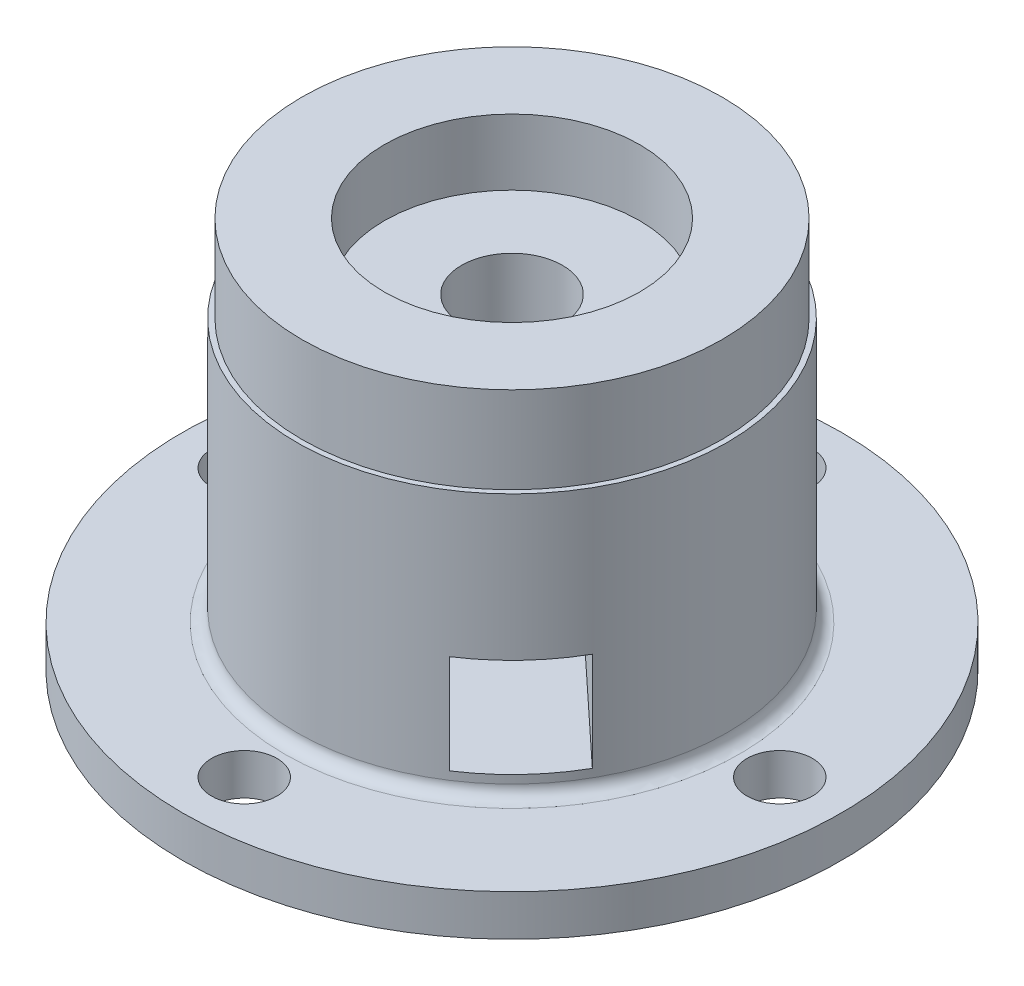
from build123d import *

# Parameters (mm, degrees)
CROQUIS1_R                  = 52.25
CROQUIS1_R_2                = 12.25
EXTRUIR_L_MINA1_DEPTH       = 64
CROQUIS3_R                  = 80
CROQUIS3_R_2                = 17.25
SALIENTE_EXTRUIR1_DEPTH     = 10
EXTRUIR_L_MINA2_OUTLINE_R   = 51
EXTRUIR_L_MINA2_OUTLINE_R_2 = 31
EXTRUIR_L_MINA2_DEPTH       = 21
EXTRUIR_L_MINA2_2_OUTLINE_R = 31
EXTRUIR_L_MINA2_2_DEPTH     = 5
EXTRUIR_L_MINA2_START       = 16
EXTRUIR_L_MINA2_3_OUTLINE_R = 31
EXTRUIR_L_MINA2_3_DEPTH     = 5
CORTAR_EXTRUIR2_START       = -8
CROQUIS6_R                  = 31
CORTAR_EXTRUIR2_DEPTH       = 8
CORTAR_EXTRUIR4_START       = -23
CROQUIS7_R                  = 12.25
CORTAR_EXTRUIR4_DEPTH       = 23
CROQUIS8_R                  = 7.94
CORTAR_EXTRUIR5_DEPTH       = 10
REDONDEO3_R                 = 3
CORTAR_EXTRUIR6_START       = -40
CROQUIS9_R                  = 17.25
CORTAR_EXTRUIR6_DEPTH       = 40
CROQUIS10_W                 = 24.5
CROQUIS10_H                 = 16
CORTAR_EXTRUIR7_DEPTH       = 42
CROQUIS11_W                 = 24.5
CROQUIS11_H                 = 8
CORTAR_EXTRUIR8_DEPTH       = 42


# Read off the part's stored shape, not the designer's step: Extruir-Lámina2
with BuildPart() as part:
    # Croquis1 → Extruir-Lámina1 (new body)
    with BuildSketch(Plane(origin=(0, 0, 0), x_dir=(1, 0, 0), z_dir=(0, 1, 0))):
        Circle(CROQUIS1_R)
        Circle(CROQUIS1_R_2, mode=Mode.SUBTRACT)
    extrude(amount=EXTRUIR_L_MINA1_DEPTH)

    # Croquis3 → Saliente-Extruir1 (add)
    with BuildSketch(Plane(origin=(0, 0, 0), x_dir=(1, 0, 0), z_dir=(0, 1, 0))):
        with Locations(Location((0, 0, 0), (0, 0, 270))):
            Circle(CROQUIS3_R)
        with Locations(Location((0, 0, 0), (0, 0, 270))):
            Circle(CROQUIS3_R_2, mode=Mode.SUBTRACT)
    extrude(amount=-SALIENTE_EXTRUIR1_DEPTH)

    # Extruir-Lámina2 outline → Extruir-Lámina2 (add)
    with BuildSketch(Plane(origin=(0, 64, 0), x_dir=(1, 0, 0), z_dir=(0, 1, 0))):
        Circle(EXTRUIR_L_MINA2_OUTLINE_R)
        Circle(EXTRUIR_L_MINA2_OUTLINE_R_2, mode=Mode.SUBTRACT)
    extrude(amount=EXTRUIR_L_MINA2_DEPTH)

    # Extruir-L_mina2 2 outline → Extruir-L_mina2 2 (add)
    with BuildSketch(Plane(origin=(0, 64, 0), x_dir=(1, 0, 0), z_dir=(0, 1, 0))):
        Circle(EXTRUIR_L_MINA2_2_OUTLINE_R)
    extrude(amount=EXTRUIR_L_MINA2_2_DEPTH)

    # Extruir-L_mina2 3 outline → Extruir-L_mina2 3 (add)
    with BuildSketch(Plane(origin=(0, 64, 0), x_dir=(1, 0, 0), z_dir=(0, 1, 0)).offset(EXTRUIR_L_MINA2_START)):
        Circle(EXTRUIR_L_MINA2_3_OUTLINE_R)
    extrude(amount=EXTRUIR_L_MINA2_3_DEPTH)

    # Croquis6 → Cortar-Extruir2 (cut)
    with BuildSketch(Plane(origin=(0, 85, 0), x_dir=(1, 0, 0), z_dir=(0, 1, 0)).offset(CORTAR_EXTRUIR2_START)):
        with Locations(Location((0, 0, 0), (0, 0, 270))):
            Circle(CROQUIS6_R)
    extrude(amount=CORTAR_EXTRUIR2_DEPTH, mode=Mode.SUBTRACT)

    # Croquis7 → Cortar-Extruir4 (cut)
    with BuildSketch(Plane(origin=(0, 69, 0), x_dir=(1, 0, 0), z_dir=(0, 1, 0)).offset(CORTAR_EXTRUIR4_START)):
        with Locations(Location((0, 0, 0), (0, 0, 270))):
            Circle(CROQUIS7_R)
    extrude(amount=CORTAR_EXTRUIR4_DEPTH, mode=Mode.SUBTRACT)

    # Croquis8 → Cortar-Extruir5 (cut)
    with BuildSketch(Plane(origin=(0, 0, 0), x_dir=(1, 0, 0), z_dir=(0, 1, 0))):
        with Locations(Location((0, 65, 0), (0, 0, 270))):
            Circle(CROQUIS8_R)
        with Locations(Location((65, 0, 0), (0, 0, 270))):
            Circle(CROQUIS8_R)
        with Locations(Location((0, -65, 0), (0, 0, 270))):
            Circle(CROQUIS8_R)
        with Locations(Location((-65, 0, 0), (0, 0, 270))):
            Circle(CROQUIS8_R)
    extrude(amount=-CORTAR_EXTRUIR5_DEPTH, mode=Mode.SUBTRACT)

    # Redondeo3
    redondeo3_edges = [part.edges().sort_by_distance(p)[0] for p in [
        (-52.25, 0, 0),
    ]]
    fillet(redondeo3_edges, radius=REDONDEO3_R)

    # Croquis9 → Cortar-Extruir6 (cut)
    with BuildSketch(Plane(origin=(0, -10, 0), x_dir=(-1, 0, 0), z_dir=(0, -1, 0)).offset(CORTAR_EXTRUIR6_START)):
        with Locations(Location((0, 0, 0), (0, 0, 270))):
            Circle(CROQUIS9_R)
    extrude(amount=CORTAR_EXTRUIR6_DEPTH, mode=Mode.SUBTRACT)

    # Croquis10 → Cortar-Extruir7 (cut)
    with BuildSketch(Plane(origin=(38.228136726, 0, 35.618423077), x_dir=(0.6816923076923129, 0, -0.7316389803947908), z_dir=(0.7316389803947908, 0, 0.6816923076923129))):
        with Locations((-0.249897299, 21)):
            Rectangle(CROQUIS10_W, CROQUIS10_H)
    extrude(amount=-CORTAR_EXTRUIR7_DEPTH, mode=Mode.SUBTRACT)

    # Croquis11 → Cortar-Extruir8 (cut)
    with BuildSketch(Plane(origin=(38.228136726, 0, 35.618423077), x_dir=(0.6816923076923129, 0, -0.7316389803947908), z_dir=(0.7316389803947908, 0, 0.6816923076923129))):
        with Locations((-0.249897299, 9)):
            Rectangle(CROQUIS11_W, CROQUIS11_H)
    extrude(amount=-CORTAR_EXTRUIR8_DEPTH, mode=Mode.SUBTRACT)


solid = part.part
